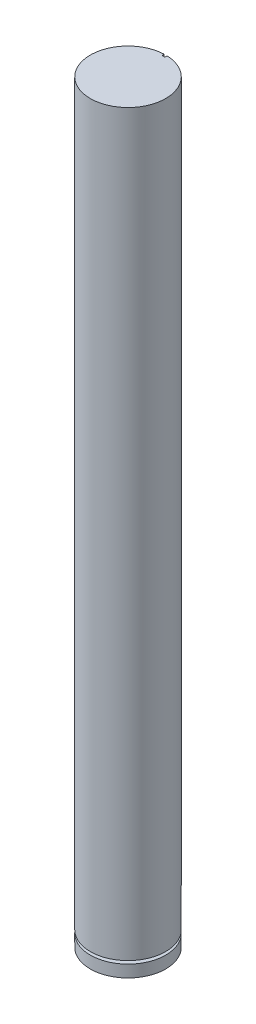
from build123d import *

# Parameters (mm, degrees)
SKETCH1_R           = 2.5
BOSS_EXTRUDE1_DEPTH = 50
SKETCH2_W           = 0.5
SKETCH2_H           = 0.2
SKETCH3_W           = 0.2
SKETCH3_H           = 0.15
CUT_EXTRUDE1_DEPTH  = 3


with BuildPart() as part:
    # Sketch1 → Boss-Extrude1 (new body)
    with BuildSketch(Plane(origin=(0, 0, 0), x_dir=(1, 0, 0), z_dir=(0, 1, 0))):
        Circle(SKETCH1_R)
    extrude(amount=BOSS_EXTRUDE1_DEPTH)

    # Sketch2 → Cut-Revolve1 (revolve, cut)
    with BuildSketch(Plane(origin=(0, 0, 0), x_dir=(0, 0, -1), z_dir=(1, 0, 0))):
        with Locations((2.25, 0.9)):
            Rectangle(SKETCH2_W, SKETCH2_H)
    revolve(axis=Axis((0, 0, 0), (0, 1, 0)), mode=Mode.SUBTRACT)

    # Sketch3 → Cut-Extrude1 (cut)
    with BuildSketch(Plane(origin=(0, 50, 0), x_dir=(1, 0, 0), z_dir=(0, 1, 0))):
        with Locations((0, 2.425)):
            Rectangle(SKETCH3_W, SKETCH3_H)
    extrude(amount=-CUT_EXTRUDE1_DEPTH, mode=Mode.SUBTRACT)


solid = part.part
